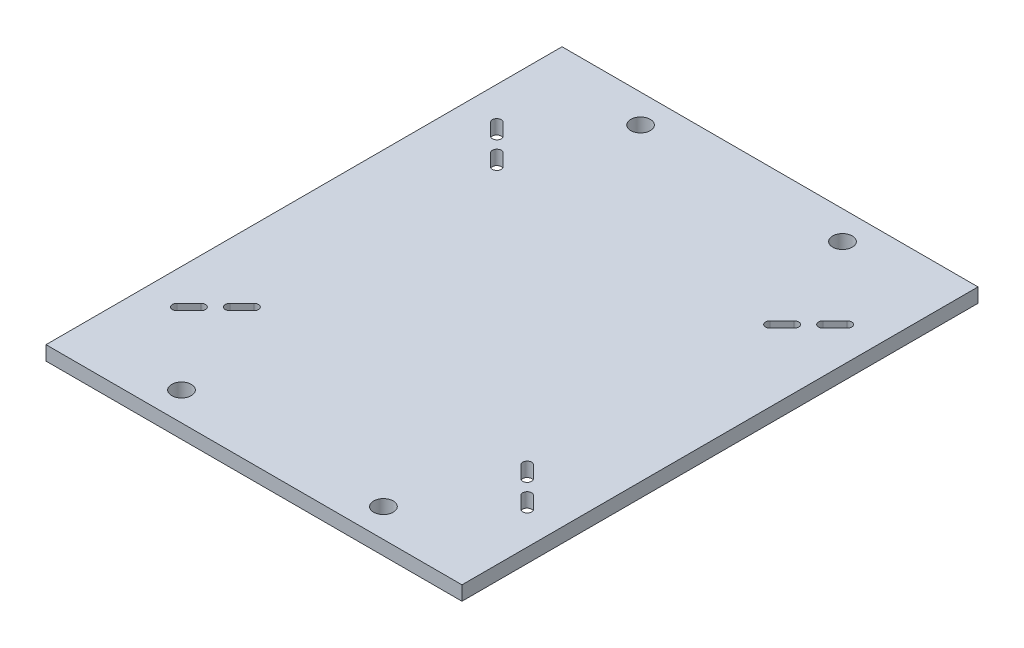
from build123d import *

# Parameters (mm, degrees)
SKETCH1_W              = 185.4
SKETCH1_H              = 230
BASE_PLATE_DEPTH       = 6.35
SLOTS_DEPTH            = 296.488548847
FEET_CONNECTION_HOLE_D = 8.7376


with BuildPart() as part:
    # Sketch1 → base plate (new body)
    with BuildSketch(Plane(origin=(0, 0, 0), x_dir=(1, 0, 0), z_dir=(0, 1, 0))):
        with Locations((92.7, -115)):
            Rectangle(SKETCH1_W, SKETCH1_H)
    extrude(amount=-BASE_PLATE_DEPTH)

    # Sketch3 → slots (cut, through all)
    with BuildSketch(Plane(origin=(0, 0, 0), x_dir=(1, 0, 0), z_dir=(0, 1, 0))):
        with BuildLine():
            Line((18.59618524, -179.525387544), (13.208031568, -184.913541217))
            ThreePointArc((13.208031568, -184.913541217), (13.208031568, -187.741968432), (16.036458783, -187.741968432))
            Line((16.036458783, -187.741968432), (21.424612456, -182.35381476))
            ThreePointArc((21.424612456, -182.35381476), (21.424612456, -179.525387544), (18.59618524, -179.525387544))
        make_face()
        with BuildLine():
            Line((27.845142119, -175.933285096), (33.233295792, -170.545131423))
            ThreePointArc((33.233295792, -170.545131423), (33.233295792, -167.716704208), (30.404868577, -167.716704208))
            Line((30.404868577, -167.716704208), (25.016714904, -173.104857881))
            ThreePointArc((25.016714904, -173.104857881), (25.016714904, -175.933285096), (27.845142119, -175.933285096))
        make_face()
        with BuildLine():
            ThreePointArc((16.036458783, -42.258031568), (13.208031568, -42.258031568), (13.208031568, -45.086458783))
            Line((13.208031568, -45.086458783), (18.59618524, -50.474612456))
            ThreePointArc((18.59618524, -50.474612456), (21.424612456, -50.474612456), (21.424612456, -47.64618524))
            Line((21.424612456, -47.64618524), (16.036458783, -42.258031568))
        make_face()
        with BuildLine():
            ThreePointArc((30.404868577, -62.283295792), (33.233295792, -62.283295792), (33.233295792, -59.454868577))
            Line((33.233295792, -59.454868577), (27.845142119, -54.066714904))
            ThreePointArc((27.845142119, -54.066714904), (25.016714904, -54.066714904), (25.016714904, -56.895142119))
            Line((25.016714904, -56.895142119), (30.404868577, -62.283295792))
        make_face()
        with BuildLine():
            Line((166.80381476, -50.474612456), (172.191968432, -45.086458783))
            ThreePointArc((172.191968432, -45.086458783), (172.191968432, -42.258031568), (169.363541217, -42.258031568))
            Line((169.363541217, -42.258031568), (163.975387544, -47.64618524))
            ThreePointArc((163.975387544, -47.64618524), (163.975387544, -50.474612456), (166.80381476, -50.474612456))
        make_face()
        with BuildLine():
            Line((157.554857881, -54.066714904), (152.166704208, -59.454868577))
            ThreePointArc((152.166704208, -59.454868577), (152.166704208, -62.283295792), (154.995131423, -62.283295792))
            Line((154.995131423, -62.283295792), (160.383285096, -56.895142119))
            ThreePointArc((160.383285096, -56.895142119), (160.383285096, -54.066714904), (157.554857881, -54.066714904))
        make_face()
        with BuildLine():
            ThreePointArc((154.995131423, -167.716704208), (152.166704208, -167.716704208), (152.166704208, -170.545131423))
            Line((152.166704208, -170.545131423), (157.554857881, -175.933285096))
            ThreePointArc((157.554857881, -175.933285096), (160.383285096, -175.933285096), (160.383285096, -173.104857881))
            Line((160.383285096, -173.104857881), (154.995131423, -167.716704208))
        make_face()
        with BuildLine():
            ThreePointArc((169.363541217, -187.741968432), (172.191968432, -187.741968432), (172.191968432, -184.913541217))
            Line((172.191968432, -184.913541217), (166.80381476, -179.525387544))
            ThreePointArc((166.80381476, -179.525387544), (163.975387544, -179.525387544), (163.975387544, -182.35381476))
            Line((163.975387544, -182.35381476), (169.363541217, -187.741968432))
        make_face()
    extrude(amount=-SLOTS_DEPTH, mode=Mode.SUBTRACT)

    # Feet connection hole (through all)
    with Locations(Plane(origin=(0, 0, 0), x_dir=(1, 0, 0), z_dir=(0, 1, 0))):
        with Locations((47.7, -217.3), (137.7, -12.7), (47.7, -12.7), (137.7, -217.3)):
            Hole(FEET_CONNECTION_HOLE_D / 2)


solid = part.part
